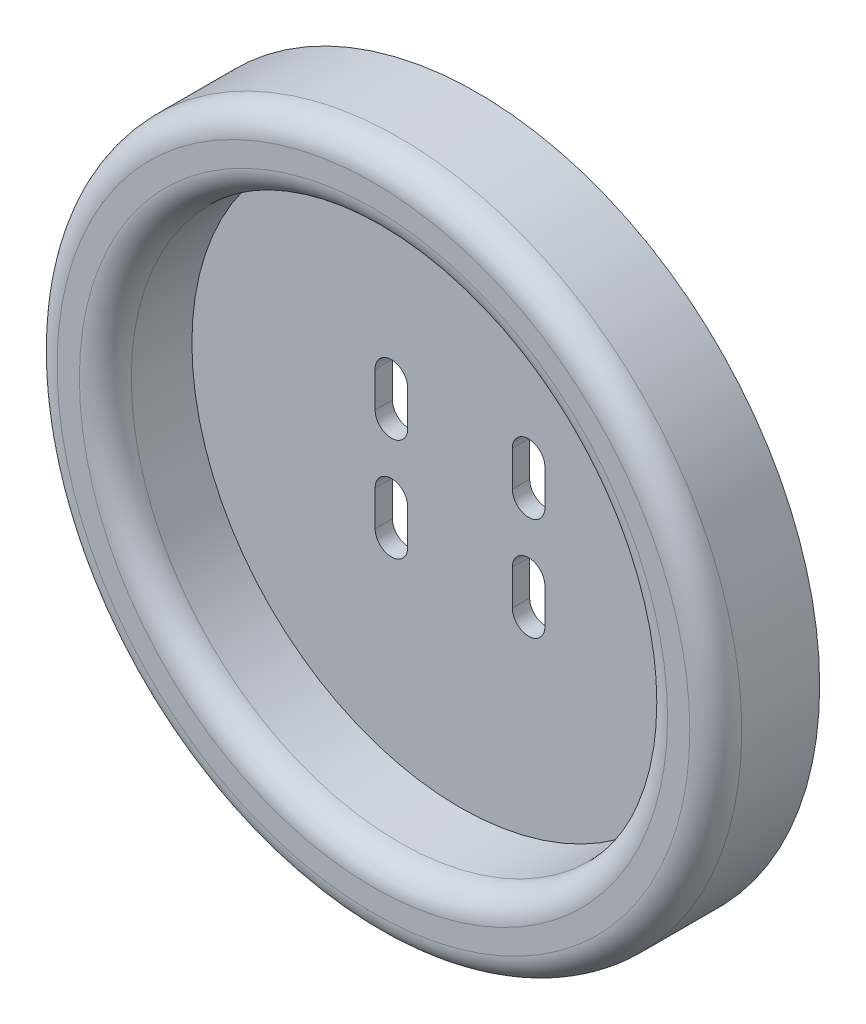
from build123d import *

# Parameters (mm, degrees)
BOSS_EXTRUDE1_OUTLINE_R = 39.549034963
BOSS_EXTRUDE1_DEPTH     = 12
SKETCH2_R               = 30.977240476
CUT_EXTRUDE1_DEPTH      = 10
FILLET1_R               = 3
FILLET3_R               = 3
CUT_EXTRUDE2_DEPTH      = 10


# Read off the part's stored shape, not the designer's step: Boss-Extrude1
with BuildPart() as part:
    # Boss-Extrude1 outline → Boss-Extrude1 (new body)
    with BuildSketch(Plane.XY):
        Circle(BOSS_EXTRUDE1_OUTLINE_R)
    extrude(amount=BOSS_EXTRUDE1_DEPTH)

    # Sketch2 → Cut-Extrude1 (cut)
    with BuildSketch(Plane.XY.offset(12)):
        Circle(SKETCH2_R)
    extrude(amount=-CUT_EXTRUDE1_DEPTH, mode=Mode.SUBTRACT)

    # Fillet1
    fillet1_edges = [part.edges().sort_by_distance(p)[0] for p in [
        (-39.549034963, 0, 12),
    ]]
    fillet(fillet1_edges, radius=FILLET1_R)

    # Fillet3
    fillet3_edges = [part.edges().sort_by_distance(p)[0] for p in [
        (-30.977240476, 0, 12),
    ]]
    fillet(fillet3_edges, radius=FILLET3_R)

    # Sketch3 → Cut-Extrude2 (cut)
    with BuildSketch(Plane.XY.offset(2)):
        with BuildLine():
            Line((-6.044621496, 7.992332867), (-6.044621496, 3.895422742))
            ThreePointArc((-6.044621496, 3.895422742), (-7.925170406, 2.014873832), (-9.805719315, 3.895422742))
            Line((-9.805719315, 3.895422742), (-9.805719315, 7.992332867))
            ThreePointArc((-9.805719315, 7.992332867), (-7.925170406, 9.872881776), (-6.044621496, 7.992332867))
        make_face()
        with BuildLine():
            Line((6.044621496, 7.992332867), (6.044621496, 3.895422742))
            ThreePointArc((6.044621496, 3.895422742), (7.925170406, 2.014873832), (9.805719315, 3.895422742))
            Line((9.805719315, 3.895422742), (9.805719315, 7.992332867))
            ThreePointArc((9.805719315, 7.992332867), (7.925170406, 9.872881776), (6.044621496, 7.992332867))
        make_face()
        with BuildLine():
            Line((6.044621496, -7.992332867), (6.044621496, -3.895422742))
            ThreePointArc((6.044621496, -3.895422742), (7.925170406, -2.014873832), (9.805719315, -3.895422742))
            Line((9.805719315, -3.895422742), (9.805719315, -7.992332867))
            ThreePointArc((9.805719315, -7.992332867), (7.925170406, -9.872881776), (6.044621496, -7.992332867))
        make_face()
        with BuildLine():
            Line((-6.044621496, -7.992332867), (-6.044621496, -3.895422742))
            ThreePointArc((-6.044621496, -3.895422742), (-7.925170406, -2.014873832), (-9.805719315, -3.895422742))
            Line((-9.805719315, -3.895422742), (-9.805719315, -7.992332867))
            ThreePointArc((-9.805719315, -7.992332867), (-7.925170406, -9.872881776), (-6.044621496, -7.992332867))
        make_face()
    extrude(amount=-CUT_EXTRUDE2_DEPTH, mode=Mode.SUBTRACT)


solid = part.part
